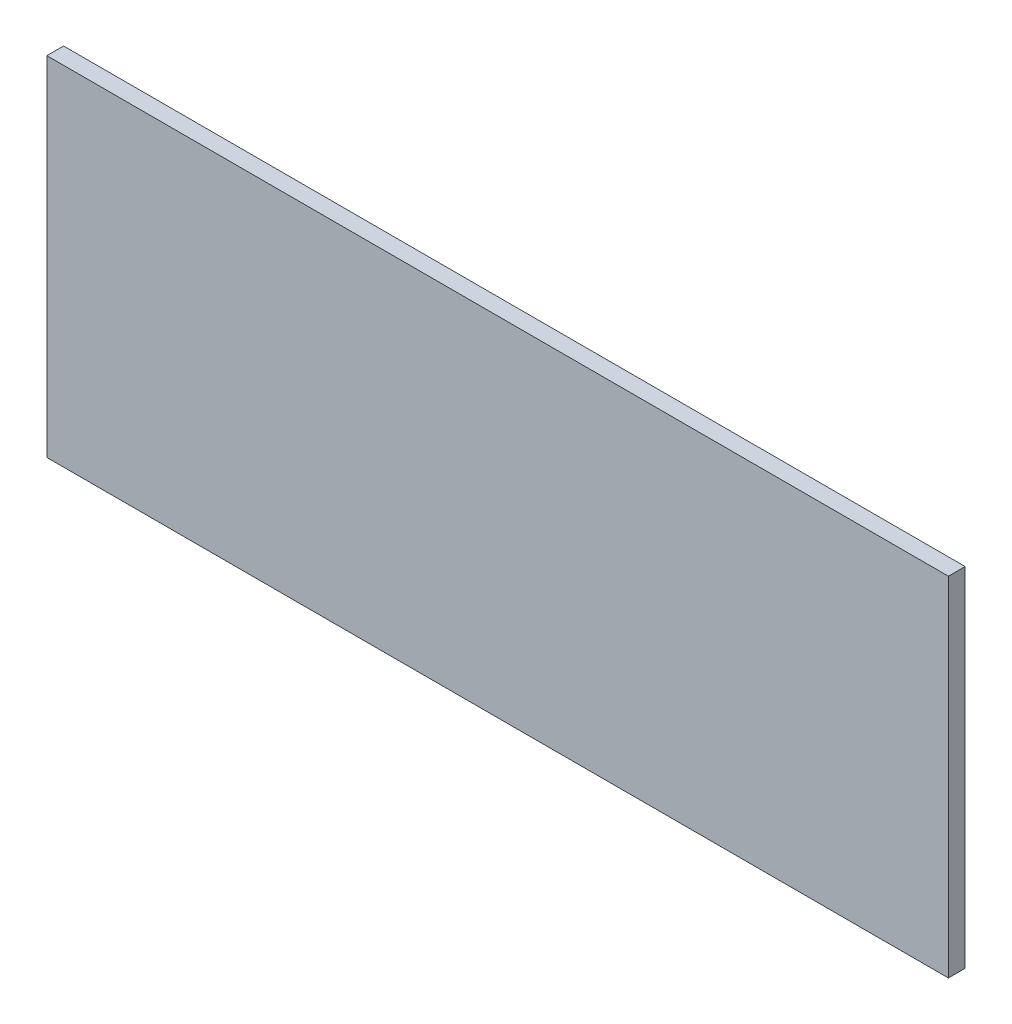
from build123d import *

# Parameters (mm, degrees)
SKETCH1_W           = 342
SKETCH1_H           = 132
BOSS_EXTRUDE1_DEPTH = 6.35


with BuildPart() as part:
    # Sketch1 → Boss-Extrude1 (new body)
    with BuildSketch(Plane.XY):
        with Locations((171, 66)):
            Rectangle(SKETCH1_W, SKETCH1_H)
    extrude(amount=BOSS_EXTRUDE1_DEPTH)


solid = part.part
